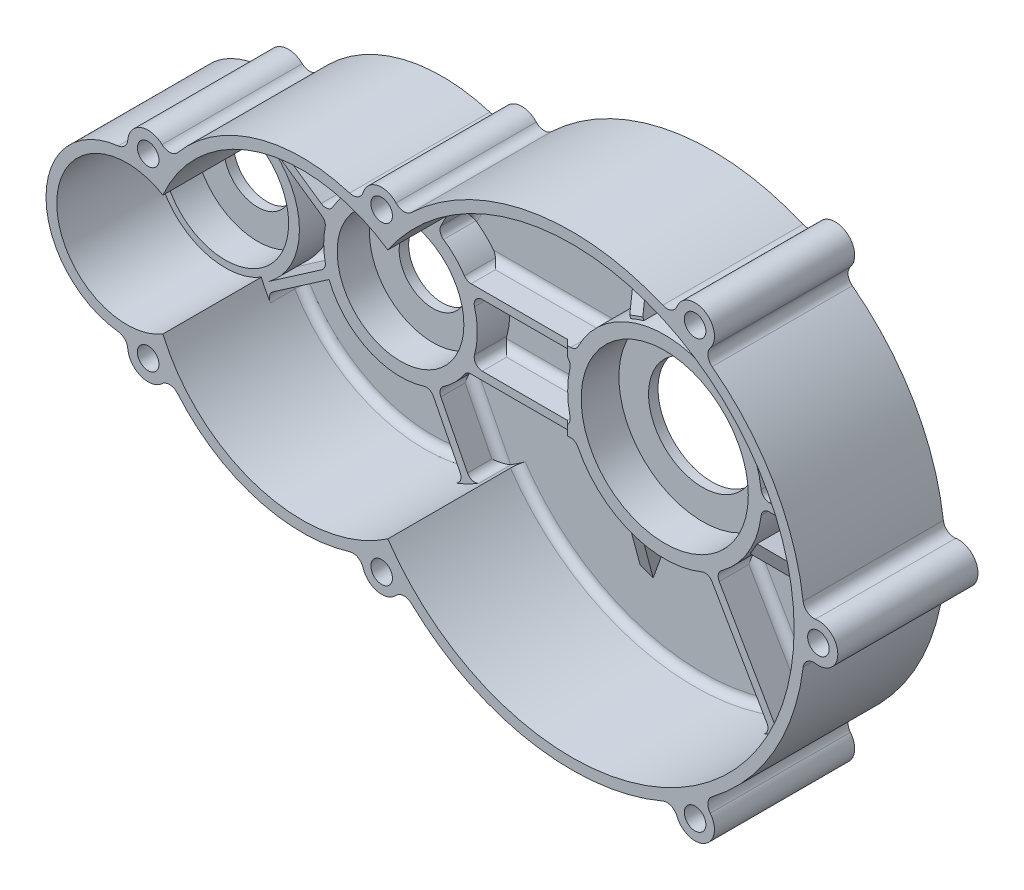
from build123d import *
from OCP.BRepFilletAPI import BRepFilletAPI_MakeChamfer
from build123d.topology import SkipClean

# Parameters (mm, degrees)
WALL_DEPTH                 = 48.5
PLATE_START                = -5
PLATE_DEPTH                = 5
SKETCH3_R                  = 12.5
SKETCH3_R_2                = 20.000000000000018
SKETCH3_R_3                = 12.500000000000002
SHAFT_HOLES_DEPTH          = 5
MOUNT_START                = -53.5
SKETCH5_R                  = 4.000000000000007
SKETCH5_R_2                = 3.9999999999999933
MOUNT_HOLES_DEPTH          = 53.5
SKETCH6_R                  = 23.499999999999996
SKETCH6_R_2                = 30.999999999999993
STIFFNERS_DEPTH            = 12
F_3MM_FILLET_R             = 3
SKETCH9_R                  = 30.999999999999993
SKETCH9_R_2                = 20.000000000000018
OUTPUT_BEARING_WIDTH_DEPTH = 2
F_4MM_FILLET_R             = 4
CUT_EXTRUDE2_DEPTH         = 1.5
FILLET1_R                  = 3
BOSS_EXTRUDE1_START        = -52
SKETCH12_R                 = 5.450634228403444
SKETCH12_R_2               = 4.000000000000007
BOSS_EXTRUDE1_DEPTH        = 52
CUT_EXTRUDE4_START         = -52
SKETCH13_R                 = 4.000000000000017
SKETCH13_R_2               = 4.000000000000002
CUT_EXTRUDE4_DEPTH         = 52
SKETCH15_R                 = 30.999999999999993
SKETCH15_R_2               = 20.000000000000018
BOSS_EXTRUDE3_DEPTH        = 2
CHAMFER1_SIZE              = 12
CHAMFER1_SIZE_2            = 24
SKETCH18_R                 = 30.999999999999993
BOSS_EXTRUDE4_DEPTH        = 2
CHAMFER2_SIZE              = 2


# Some blends are built 0.0001 mm under size
with BuildPart() as part:
    # Sketch1 → wall (new body)
    with BuildSketch(Plane.XY):
        with BuildLine():
            ThreePointArc((11.499519230769218, -27.708501537635847), (48.42153925111643, -57.924236198656324), (95.73906249999997, -51.818650470859374))
            ThreePointArc((95.73906249999997, -51.818650470859374), (251.49999999999997, 0), (95.7390625, 51.818650470859374))
            ThreePointArc((95.7390625, 51.818650470859374), (48.42153925111643, 57.924236198656324), (11.499519230769211, 27.708501537635847))
            ThreePointArc((11.499519230769211, 27.708501537635847), (-29.999999999999982, 3.67e-15), (11.499519230769218, -27.708501537635847))
        make_face()
        with BuildLine():
            ThreePointArc((96.78906249999999, 46.40601259935069), (49.38822629838255, 54.040124184623096), (13.361057692307707, 22.304307596130975))
            ThreePointArc((13.361057692307707, 22.304307596130975), (-26.000000000000018, 3.18e-15), (13.361057692307707, -22.304307596130975))
            ThreePointArc((13.361057692307707, -22.304307596130975), (49.38822629838256, -54.04012418462308), (96.7890625, -46.406012599350674))
            ThreePointArc((96.7890625, -46.406012599350674), (247.49999999999994, 0), (96.78906249999999, 46.40601259935069))
        make_face(mode=Mode.SUBTRACT)
    extrude(amount=WALL_DEPTH)

    # Sketch2 → plate (add)
    with BuildSketch(Plane.XY.offset(PLATE_START)):
        with BuildLine():
            ThreePointArc((11.499519230769224, 27.708501537635843), (-29.999999999999986, 3.67e-15), (11.499519230769224, -27.708501537635843))
            ThreePointArc((11.499519230769224, -27.708501537635843), (48.4215392511164, -57.92423619865631), (95.73906249999995, -51.8186504708594))
            ThreePointArc((95.73906249999995, -51.8186504708594), (251.5, 0), (95.7390625, 51.81865047085939))
            ThreePointArc((95.7390625, 51.81865047085939), (48.421539251116414, 57.92423619865634), (11.499519230769224, 27.708501537635843))
        make_face()
    extrude(amount=PLATE_DEPTH)

    # Sketch3 → shaft holes (cut)
    with BuildSketch(Plane.XY):
        Circle(SKETCH3_R)
        with Locations((164.99999999999997, 0)):
            Circle(SKETCH3_R_2)
        with Locations((65, 0)):
            Circle(SKETCH3_R_3)
    extrude(amount=-SHAFT_HOLES_DEPTH, mode=Mode.SUBTRACT)

    # Sketch5 → mount holes (add)
    # profile 1 of 7: a face of its own
    with BuildSketch(Plane.XY.offset(48.5).offset(MOUNT_START)):
        with BuildLine():
            ThreePointArc((101.66667908580902, 58.9163853438082), (92.93813083409786, 65.21411062740518), (87.70840140116725, 55.806729036949406))
            ThreePointArc((87.70840140116712, 55.80672903694924), (91.79802309926924, 53.96228736785567), (95.73906250000002, 51.81865047085939))
            ThreePointArc((95.7390625, 51.818650470859396), (98.60795378071266, 55.446787091913784), (101.66667908580901, 58.91638534380822))
        make_face()
        with Locations((94.50378031527595, 58.18639821851372)):
            Circle(SKETCH5_R, mode=Mode.SUBTRACT)
    # profile 2 of 7: a face of its own
    with BuildSketch(Plane.XY.offset(48.5).offset(MOUNT_START)):
        with BuildLine():
            Line((9.26823122222287, 29.06952845339508), (9.490438783626573, 28.459296753333007))
            ThreePointArc((9.49043878362604, 28.45929675333257), (10.501690707952559, 28.101859231632734), (11.499519230769211, 27.708501537635847))
            ThreePointArc((11.499519230769195, 27.708501537635858), (13.338247725786175, 31.00202980383327), (15.379467603321658, 34.174043727223726))
            ThreePointArc((15.379467603321867, 34.17404372722366), (5.7955127863149585, 40.13103049599079), (0.8502337303878988, 29.987949289734694))
            ThreePointArc((0.8502337303879592, 29.98794928973486), (3.3240631808321917, 29.815274675404797), (5.775179497135638, 29.438873989605362))
            ThreePointArc((5.775179497135632, 29.43887398960535), (5.96280795706429, 36.32793240711279), (11.89959924691495, 32.82809819681673))
            ThreePointArc((11.89959924691495, 32.82809819681673), (11.1763757041387, 30.534032799016536), (9.268231222222871, 29.069528453395073))
        make_face()
    # profile 3 of 7: a face of its own
    with BuildSketch(Plane.XY.offset(48.5).offset(MOUNT_START)):
        with BuildLine():
            ThreePointArc((217.9499999999998, 79.24132444627627), (209.7711033604413, 86.37446971109887), (203.81617739748285, 77.3017100214936))
            ThreePointArc((203.81617739748305, 77.30171002149383), (208.24999999999994, 74.91119742735394), (212.53715593585014, 72.26665071477065))
            ThreePointArc((212.53715593585014, 72.26665071477062), (216.4380366884417, 74.82700245632823), (217.9499999999998, 79.24132444627627))
        make_face()
        with Locations((210.7499999999998, 79.24132444627627)):
            Circle(SKETCH5_R_2, mode=Mode.SUBTRACT)
    # profile 4 of 7: a face of its own
    with BuildSketch(Plane.XY.offset(48.5).offset(MOUNT_START)):
        with BuildLine():
            ThreePointArc((217.9499999999998, -79.24132444627627), (216.43803668844177, -74.82700245632829), (212.53715593585028, -72.26665071477065))
            ThreePointArc((212.53715593585028, -72.26665071477063), (208.25, -74.91119742735398), (203.81617739748307, -77.30171002149392))
            ThreePointArc((203.81617739748282, -77.30171002149368), (209.77110336044132, -86.37446971109887), (217.9499999999998, -79.24132444627627))
        make_face()
        with Locations((210.7499999999998, -79.24132444627627)):
            Circle(SKETCH5_R_2, mode=Mode.SUBTRACT)
    # profile 5 of 7: a face of its own
    with BuildSketch(Plane.XY.offset(48.5).offset(MOUNT_START)):
        with BuildLine():
            ThreePointArc((95.73906249999999, -51.81865047085938), (91.79802309926922, -53.962287367855666), (87.70840140116712, -55.80672903694922))
            ThreePointArc((87.70840140116727, -55.80672903694938), (92.9381308340978, -65.21411062740516), (101.66667908580902, -58.91638534380828))
            ThreePointArc((101.666679085809, -58.9163853438083), (98.60795378071265, -55.446787091913855), (95.73906249999995, -51.8186504708594))
        make_face()
        with Locations((94.50378031527595, -58.18639821851372)):
            Circle(SKETCH5_R, mode=Mode.SUBTRACT)
    # profile 6 of 7: a face of its own
    with BuildSketch(Plane.XY.offset(48.5).offset(MOUNT_START)):
        with BuildLine():
            ThreePointArc((5.775179497135616, -29.438873989605376), (3.32406318083218, -29.815274675404805), (0.8502337303879735, -29.987949289734868))
            ThreePointArc((0.8502337303878997, -29.987949289734694), (5.79551278631497, -40.1310304959908), (15.37946760332187, -34.17404372722364))
            ThreePointArc((15.379467603321679, -34.17404372722369), (13.33824772578619, -31.00202980383326), (11.499519230769216, -27.708501537635847))
            ThreePointArc((11.499519230769204, -27.708501537635858), (9.890853137572314, -28.32262389347031), (8.249602696185828, -28.843440421612033))
            ThreePointArc((8.249602696185844, -28.84344042161213), (10.849176657077596, -30.12624825622821), (11.89959924691495, -32.82809819681673))
            ThreePointArc((11.89959924691495, -32.82809819681673), (5.962807957064298, -36.3279324071128), (5.775179497135614, -29.438873989605366))
        make_face()
    # profile 7 of 7: a face of its own
    with BuildSketch(Plane.XY.offset(48.5).offset(MOUNT_START)):
        with BuildLine():
            ThreePointArc((263.7, 0), (259.2188232748746, 6.6669333280002085), (251.3533333333333, 5.0350593067233405))
            ThreePointArc((251.35333333333332, 5.035059306723314), (251.5, -4.086e-14), (251.35333333333332, -5.035059306723381))
            ThreePointArc((251.3533333333333, -5.035059306723358), (259.2188232748746, -6.666933328000204), (263.7, -1.76e-15))
        make_face()
        with Locations((256.5, 0)):
            Circle(SKETCH5_R_2, mode=Mode.SUBTRACT)
    extrude(amount=MOUNT_HOLES_DEPTH)

    # Sketch6 → Stiffners (add)
    with BuildSketch(Plane.XY):
        with BuildLine():
            Line((38.49565795212308, 10.477110890371637), (15.361110193046382, 26.45832796555964))
            ThreePointArc((15.361110193046379, 26.45832796555964), (14.650603173573039, 25.07988714518038), (13.978365384615408, 23.682383773053473))
            ThreePointArc((13.978365384615401, 23.68238377305348), (13.665087055376269, 22.995417216652143), (13.36105769230771, 22.304307596130975))
            ThreePointArc((13.361057692307707, 22.304307596130975), (-26.000000000000018, 2.66e-15), (13.361057692307707, -22.304307596130972))
            ThreePointArc((13.361057692307703, -22.30430759613098), (13.665087055376254, -22.995417216652143), (13.978365384615394, -23.682383773053488))
            ThreePointArc((13.978365384615415, -23.68238377305348), (14.650603173573039, -25.07988714518039), (15.361110193046379, -26.458327965559644))
            Line((15.361110193046382, -26.45832796555964), (38.495657952123096, -10.477110890371636))
            ThreePointArc((38.495657952123096, -10.477110890371629), (53.929607396747244, -26.262071654952244), (76.00608927382068, -26.289085166598902))
            Line((76.00608927382068, -26.289085166598888), (88.57264066064552, -51.072430060494305))
            ThreePointArc((88.57264066064552, -51.07243006049431), (89.9262590361775, -50.42562949990193), (91.2621470799294, -49.7429606150675))
            Line((91.2621470799294, -49.742960615067496), (78.70908383956089, -24.986216605958777))
            ThreePointArc((78.70908383956089, -24.986216605958774), (84.82436425632805, -20.475462921077565), (89.5303135118925, -14.5090909090909))
            Line((89.5303135118925, -14.509090909090904), (132.05328118018826, -14.509090909090904))
            ThreePointArc((132.05328118018826, -14.509090909090904), (139.50484136144325, -25.41646879475638), (150.38913268183015, -32.90171053624472))
            Line((150.38913268183015, -32.901710536244714), (141.8702883993316, -56.50059353862132))
            Line((141.8702883993316, -56.50059353862132), (144.22176781945507, -57.34944248674798))
            Line((144.22176781945507, -57.34944248674798), (146.70761749215703, -58.246797089053324))
            Line((146.70761749215703, -58.246797089053324), (155.22646177465555, -34.647914086676714))
            ThreePointArc((155.22646177465555, -34.64791408667671), (168.44150012774992, -35.835123508517405), (181.18905024214683, -32.154543259969415))
            Line((181.18905024214683, -32.154543259969415), (204.95552203895156, -73.31927992868806))
            Line((204.95552203895156, -73.31927992868806), (206.0662177137105, -75.24306126911748))
            Line((206.0662177137105, -75.24306126911748), (208.66429392506384, -73.74306126911746))
            Line((208.66429392506384, -73.74306126911746), (207.54404600113688, -71.80273494780248))
            Line((207.54404600113688, -71.80273494780248), (183.8103637094438, -30.69479136789232))
            ThreePointArc((183.8103637094438, -30.69479136789232), (189.7796734340188, -26.114512909556225), (194.66656248566662, -20.39350559085019))
            Line((194.66656248566662, -20.39350559085019), (215.44417626570595, -32.588300443139836))
            Line((215.44417626570595, -32.588300443139836), (216.70961894883547, -30.432226507553672))
            Line((216.70961894883547, -30.432226507553672), (218.04737264242948, -28.152948347076958))
            Line((218.04737264242948, -28.152948347076958), (197.2697588623901, -15.958153494787352))
            ThreePointArc((197.2697588623901, -15.958153494787355), (199.87667716951003, -8.922857704445132), (200.96873642484536, -1.4999999999999987))
            Line((200.96873642484536, -1.5), (247.4613630023896, -1.5))
            Line((247.4613630023896, -1.5), (249.23500443972713, -1.5))
            Line((249.23500443972713, -1.5), (249.23500443972713, 1.5))
            Line((249.23500443972713, 1.5), (247.4613630023896, 1.5))
            Line((247.4613630023896, 1.5), (200.96873642484536, 1.5))
            ThreePointArc((200.96873642484536, 1.5), (199.87667716951003, 8.922857704445134), (197.2697588623901, 15.958153494787352))
            Line((197.2697588623901, 15.958153494787352), (218.04737264242948, 28.152948347076958))
            Line((218.04737264242948, 28.152948347076958), (216.70961894883547, 30.432226507553672))
            Line((216.70961894883547, 30.432226507553672), (215.44417626570595, 32.588300443139836))
            Line((215.44417626570595, 32.588300443139836), (194.66656248566662, 20.39350559085019))
            ThreePointArc((194.66656248566662, 20.39350559085019), (189.77967343401883, 26.11451290955626), (183.8103637094438, 30.69479136789232))
            Line((183.8103637094438, 30.69479136789232), (207.54404600113688, 71.80273494780248))
            Line((207.54404600113688, 71.80273494780248), (208.66429392506382, 73.74306126911748))
            Line((208.66429392506382, 73.74306126911748), (206.06621771371047, 75.24306126911749))
            Line((206.06621771371047, 75.24306126911749), (204.95552203895156, 73.31927992868806))
            Line((204.95552203895156, 73.31927992868806), (181.18905024214683, 32.154543259969415))
            ThreePointArc((181.18905024214683, 32.15454325996943), (168.44150012774992, 35.83512350851741), (155.22646177465555, 34.64791408667672))
            Line((155.22646177465555, 34.647914086676714), (146.70761749215703, 58.246797089053324))
            Line((146.70761749215703, 58.246797089053324), (144.22176781945507, 57.34944248674798))
            Line((144.22176781945507, 57.34944248674798), (141.8702883993316, 56.50059353862132))
            Line((141.8702883993316, 56.50059353862132), (150.38913268183015, 32.901710536244714))
            ThreePointArc((150.38913268183015, 32.90171053624471), (139.50484136144325, 25.41646879475638), (132.05328118018826, 14.509090909090904))
            Line((132.05328118018826, 14.509090909090904), (89.5303135118925, 14.509090909090904))
            ThreePointArc((89.5303135118925, 14.509090909090908), (84.82436425632805, 20.47546292107758), (78.70908383956089, 24.98621660595878))
            Line((78.70908383956089, 24.986216605958777), (91.2621470799294, 49.742960615067496))
            ThreePointArc((91.2621470799294, 49.7429606150675), (89.9262590361775, 50.42562949990193), (88.57264066064552, 51.07243006049431))
            Line((88.57264066064552, 51.072430060494305), (76.00608927382068, 26.289085166598888))
            ThreePointArc((76.00608927382068, 26.289085166598884), (53.92960739674723, 26.26207165495225), (38.49565795212308, 10.477110890371636))
        make_face()
        with BuildLine():
            ThreePointArc((14.42604396178424, -18.55099069086793), (13.435981266119917, -19.280155793366266), (12.409134615384627, -19.956537227115913))
            ThreePointArc((12.40913461538461, -19.956537227115916), (-23.499999999999996, 1.421e-14), (12.409134615384627, 19.956537227115913))
            ThreePointArc((12.409134615384623, 19.956537227115913), (23.46783178961601, 1.2291749648801886), (14.42604396178424, -18.55099069086793))
        make_face(mode=Mode.SUBTRACT)
        with BuildLine():
            Line((15.630120525159256, 22.626297363223088), (36.82968655308099, 7.981754918727974))
            Line((36.82968655308099, 7.981754918727974), (37.50812138300684, 7.513095907048813))
            ThreePointArc((37.50812138300684, 7.513095907048813), (36.500000000000014, 1.78e-15), (37.50812138300684, -7.51309590704881))
            Line((37.50812138300684, -7.513095907048813), (36.82968655308099, -7.981754918727974))
            Line((36.82968655308099, -7.981754918727974), (15.630120525159256, -22.626297363223088))
            ThreePointArc((15.630120525159251, -22.626297363223095), (27.500000000000014, -4.44e-15), (15.630120525159256, 22.626297363223088))
        make_face(mode=Mode.SUBTRACT)
        with Locations((65, 0)):
            Circle(SKETCH6_R, mode=Mode.SUBTRACT)
        with BuildLine():
            ThreePointArc((91.07279859252324, -11.509090909090903), (93.50000000000001, -1.78e-15), (91.07279859252324, 11.5090909090909))
            Line((91.07279859252324, 11.5090909090909), (130.88928575291507, 11.509090909090903))
            ThreePointArc((130.88928575291507, 11.509090909090904), (128.99999999999997, -8.9e-16), (130.88928575291507, -11.509090909090904))
            Line((130.88928575291507, -11.509090909090903), (91.07279859252324, -11.5090909090909))
        make_face(mode=Mode.SUBTRACT)
        with Locations((164.99999999999997, 0)):
            Circle(SKETCH6_R_2, mode=Mode.SUBTRACT)
    extrude(amount=STIFFNERS_DEPTH)

    # 3mm fillet
    f_3mm_fillet_edges = [part.edges().sort_by_distance(p)[0] for p in [
        (110.98104217271916, -11.5090909090909, 0),
        (110.98104217271916, 11.5090909090909, 0),
        (26.569120954083047, 15.069696635135951, 0),
        (26.569120954083047, -15.069696635135951, 0),
        (82.2893649672331, -38.6807576135466, 0),
        (192.82234326351562, -52.30399783231661, 0),
        (145.60066709662624, -80.1867562812219, 0),
        (84.98561545974515, -37.36458861051314, 0),
        (224.2275494670252, -1.4999999999999993, 0),
        (236.30738743441992, -41.49104116887794, 0),
        (195.43710399088877, -50.83289626176263, 0),
        (195.43710399088877, 50.83289626176265, 0),
        (236.30738743441995, 41.49104116887794, 0),
        (224.2275494670252, 1.5, 0),
        (84.98561545974515, 37.36458861051314, 0),
        (145.60066709662627, 80.1867562812219, 0),
        (192.82234326351562, 52.30399783231663, 0),
        (26.928384072584734, 18.467719427965637, 0),
        (47.07443608629511, 53.31732043506765, 0),
        (82.2893649672331, 38.6807576135466, 0),
        (91.07279859252324, -11.5090909090909, 6),
        (91.07279859252324, 11.5090909090909, 6),
        (130.88928575291507, 11.509090909090904, 6),
        (130.88928575291507, -11.5090909090909, 6),
        (247.4863625092051, 1.5, 6),
        (247.4863625092051, -1.5, 6),
        (207.06384427233368, 70.97100115563295, 6),
        (204.45563628488443, 72.45345240466398, 6),
        (181.18905024214683, 32.15454325996942, 6),
        (200.96873642484536, 1.5, 6),
        (183.8103637094438, -30.69479136789232, 6),
        (207.06384427233368, -70.97100115563296, 6),
        (204.45563628488446, -72.45345240466395, 6),
        (78.70908383956089, -24.986216605958774, 6),
        (76.00608927382068, -26.28908516659889, 6),
        (15.361110193046377, 26.45832796555964, 6),
        (88.57264066064552, 51.07243006049431, 6),
        (91.2621470799294, 49.7429606150675, 6),
        (76.00608927382068, 26.28908516659888, 6),
        (78.70908383956089, 24.98621660595878, 6),
        (37.50812138300684, -7.513095907048809, 6),
        (37.50812138300684, 7.513095907048813, 6),
        (38.49565795212308, 10.477110890371637, 6),
        (88.57264066064552, -51.07243006049431, 6),
        (91.2621470799294, -49.7429606150675, 6),
        (110.79179734604038, 14.509090909090904, 0),
        (110.79179734604038, -14.509090909090904, 0),
        (89.5303135118925, -14.5090909090909, 6),
        (89.5303135118925, 14.509090909090906, 6),
        (132.05328118018826, -14.509090909090904, 6),
        (47.074436086295115, -53.317320435067636, 0),
        (200.96873642484536, -1.4999999999999987, 6),
        (181.18905024214683, -32.154543259969415, 6),
        (26.92838407258474, -18.467719427965637, 0),
        (15.361110193046377, -26.458327965559647, 6),
        (183.8103637094438, 30.694791367892325, 6),
    ]]
    fillet(f_3mm_fillet_edges, radius=F_3MM_FILLET_R)

    # Sketch9 → output bearing width (cut)
    with BuildSketch(Plane.XY):
        with Locations((164.99999999999997, 0)):
            Circle(SKETCH9_R)
        with Locations((164.99999999999997, 0)):
            Circle(SKETCH9_R_2, mode=Mode.SUBTRACT)
    extrude(amount=-OUTPUT_BEARING_WIDTH_DEPTH, mode=Mode.SUBTRACT)

    # 4mm fillet
    f_4mm_fillet_edges = [part.edges().sort_by_distance(p)[0] for p in [
        (101.66667908580901, -58.91638534380829, 21.75),
        (87.7084014011672, -55.80672903694931, 21.75),
        (0.8502337303879346, -29.98794928973478, 21.75),
        (15.379467603321775, -34.17404372722366, 21.75),
        (251.35333333333332, -5.035059306723372, 21.75),
        (251.3533333333333, 5.0350593067233325, 21.75),
        (101.666679085809, 58.916385343808216, 21.75),
        (87.70840140116718, 55.80672903694933, 21.75),
        (15.379467603321762, 34.17404372722369, 21.75),
        (0.8502337303879282, 29.98794928973478, 21.75),
        (212.53715593585014, 72.26665071477062, 21.75),
        (203.81617739748293, 77.3017100214937, 21.75),
        (212.53715593585028, -72.26665071477063, 21.75),
        (203.81617739748293, -77.3017100214938, 21.75),
    ]]
    fillet(f_4mm_fillet_edges, radius=F_4MM_FILLET_R)

    # Sketch10 → Cut-Extrude2 (cut)
    with BuildSketch(Plane(origin=(0, 0, -5), x_dir=(-1, 0, 0), z_dir=(0, 0, -1))):
        with BuildLine():
            ThreePointArc((-82.6176970674836, -57.6166577478977), (-47.90235166391932, -57.77311590502729), (-18.863420494799847, -38.74891652111507))
            ThreePointArc((-18.863420494799847, -38.74891652111507), (-16.046136877516886, -37.32901347787043), (-13.075993198050156, -38.392713696799696))
            ThreePointArc((-13.075993198050156, -38.392713696799696), (-5.160438728778773, -39.917315336662554), (-0.32645941471191703, -33.46649703915576))
            ThreePointArc((-0.32645941471191703, -33.46649703915576), (0.7976038953600568, -31.00784043377143), (3.228885577825256, -29.825732143994575))
            ThreePointArc((3.228885577825256, -29.825732143994575), (29.999999999999986, 0), (3.2288855778252588, 29.825732143994575))
            ThreePointArc((3.2288855778252588, 29.825732143994575), (0.7976038953600564, 31.007840433771435), (-0.32645941471192047, 33.46649703915577))
            ThreePointArc((-0.32645941471192047, 33.46649703915577), (-5.160438728778768, 39.91731533666256), (-13.075993198050151, 38.39271369679971))
            ThreePointArc((-13.075993198050151, 38.39271369679971), (-16.04613687751688, 37.32901347787046), (-18.86342049479984, 38.74891652111508))
            ThreePointArc((-18.86342049479984, 38.74891652111508), (-47.9023516639193, 57.77311590502729), (-82.61769706748356, 57.61665774789772))
            ThreePointArc((-82.61769706748356, 57.61665774789772), (-85.66830507037658, 57.911680189171044), (-87.61463799555334, 60.279175822227764))
            ThreePointArc((-87.61463799555334, 60.279175822227764), (-92.92038028133871, 65.21013257656911), (-99.82861978961255, 63.03264259664271))
            ThreePointArc((-99.82861978961255, 63.03264259664271), (-102.6379731089084, 61.72777260502753), (-105.53661581198773, 62.820028182967654))
            ThreePointArc((-105.53661581198773, 62.820028182967654), (-149.64073322150355, 85.12545403125303), (-198.7591392136407, 79.64025690286307))
            ThreePointArc((-198.7591392136407, 79.64025690286307), (-201.87208948160787, 79.63633598021674), (-204.04516423576405, 81.86528659818038))
            ThreePointArc((-204.04516423576405, 81.86528659818038), (-214.34999999999977, 85.47670735352425), (-216.37483576423554, 74.74674742219776))
            ThreePointArc((-216.37483576423554, 74.74674742219776), (-215.53104528237617, 71.75033417179398), (-217.09091603497777, 69.05640062033994))
            ThreePointArc((-217.09091603497777, 69.05640062033994), (-239.91119742735387, 43.25000000000001), (-250.85005524861882, 10.583856282523007))
            ThreePointArc((-250.85005524861882, 10.583856282523007), (-252.40313476398438, 7.8860018084227095), (-255.42, 7.118539175982654))
            ThreePointArc((-255.42, 7.118539175982654), (-263.7, 8.8e-16), (-255.42, -7.118539175982638))
            ThreePointArc((-255.42, -7.118539175982638), (-252.4031347639844, -7.886001808422654), (-250.85005524861882, -10.58385628252294))
            ThreePointArc((-250.85005524861882, -10.58385628252294), (-239.91119742735395, -43.25000000000005), (-217.09091603497774, -69.05640062034004))
            ThreePointArc((-217.09091603497774, -69.05640062034004), (-215.5310452823761, -71.75033417179401), (-216.37483576423554, -74.74674742219771))
            ThreePointArc((-216.37483576423554, -74.74674742219771), (-214.3499999999998, -85.47670735352425), (-204.04516423576405, -81.86528659818038))
            ThreePointArc((-204.04516423576405, -81.86528659818038), (-201.87208948160776, -79.63633598021673), (-198.75913921364054, -79.64025690286304))
            ThreePointArc((-198.75913921364054, -79.64025690286304), (-149.64073322150344, -85.12545403125296), (-105.53661581198767, -62.820028182967654))
            ThreePointArc((-105.53661581198767, -62.820028182967654), (-102.63797310890837, -61.72777260502754), (-99.82861978961256, -63.032642596642724))
            ThreePointArc((-99.82861978961256, -63.032642596642724), (-92.9203802813387, -65.21013257656912), (-87.61463799555334, -60.27917582222775))
            ThreePointArc((-87.61463799555334, -60.27917582222775), (-85.66830507037663, -57.911680189171), (-82.6176970674836, -57.6166577478977))
        make_face()
    extrude(amount=-CUT_EXTRUDE2_DEPTH, mode=Mode.SUBTRACT)

    # Fillet1
    # the kernel refuses this fillet: 3 mm, written as the material it adds along each edge
    with BuildSketch(Plane(origin=(132.05328118018826, 14.509090909090904, -1.7549473493717191), x_dir=(0.4261279424020825, 0.9046629077751378, 0), z_dir=(0, 0, 1))) as fillet1_piece_1:
        with BuildLine():
            CenterArc((1.9035023512382108, 2.9990336253663687), FILLET1_R, 205.22207939438857, 63.32359576393128)
            Line((-0.8104863720872026, 1.7206497981601212), (0, 0))
            ThreePointArc((0, 0), (0.9136811285943572, 0.01159649560360848), (1.82736225718868, -4e-17))
        make_face()
    extrude(amount=13.754947349371719)

    # Sketch12 → Boss-Extrude1 (add)
    with SkipClean():  # the faces are left unmerged after this step: merging them gives an invalid solid
        with BuildSketch(Plane.XY.offset(48.5).offset(BOSS_EXTRUDE1_START)):
            with Locations((7.899599246914947, 32.82809819681673)):
                Circle(SKETCH12_R)
            with Locations((7.899599246914947, 32.82809819681673)):
                Circle(SKETCH12_R_2, mode=Mode.SUBTRACT)
        extrude(amount=BOSS_EXTRUDE1_DEPTH)

    # Sketch13 → Cut-Extrude4 (cut)
    with SkipClean():  # the faces are left unmerged after this step: merging them gives an invalid solid
        with BuildSketch(Plane.XY.offset(48.5).offset(CUT_EXTRUDE4_START)):
            with Locations((7.899599246914947, 32.82809819681673)):
                Circle(SKETCH13_R)
            with Locations((7.899599246914947, -32.82809819681673)):
                Circle(SKETCH13_R_2)
        extrude(amount=CUT_EXTRUDE4_DEPTH, mode=Mode.SUBTRACT)

    # Sketch15 → Boss-Extrude3 (add)
    with BuildSketch(Plane.XY.offset(-2)):
        with Locations((164.99999999999997, 0)):
            Circle(SKETCH15_R)
        with Locations((164.99999999999997, 0)):
            Circle(SKETCH15_R_2, mode=Mode.SUBTRACT)
    extrude(amount=BOSS_EXTRUDE3_DEPTH)

    # Chamfer1
    chamfer1_edges_1 = [part.edges().sort_by_distance(p)[0] for p in [
        (144.2889529457443, -57.37369531383732, 12),
    ]]
    chamfer1_side_1 = [part.faces().sort_by_distance(p)[0] for p in [
        (144.2889529457443, -57.37369531383732, 11.76),
    ]]
    chamfer1_edges_2 = [part.edges().sort_by_distance(p)[0] for p in [
        (144.2889529457443, 57.373695313837324, 12),
    ]]
    chamfer1_side_2 = [part.faces().sort_by_distance(p)[0] for p in [
        (144.2889529457443, 57.373695313837324, 11.76),
    ]]
    chamfer1_edges_3 = [part.edges().sort_by_distance(p)[0] for p in [
        (216.7457744540677, 30.370624395108397, 12),
    ]]
    chamfer1_side_3 = [part.faces().sort_by_distance(p)[0] for p in [
        (216.7457744540677, 30.370624395108397, 11.76),
    ]]
    chamfer1_edges_4 = [part.edges().sort_by_distance(p)[0] for p in [
        (216.7457744540677, -30.370624395108397, 12),
    ]]
    chamfer1_side_4 = [part.faces().sort_by_distance(p)[0] for p in [
        (216.7457744540677, -30.370624395108397, 11.76),
    ]]
    chamfer1 = BRepFilletAPI_MakeChamfer(part.part.solid().wrapped)
    for e in chamfer1_edges_1:
        chamfer1.Add(CHAMFER1_SIZE - 0.0001, CHAMFER1_SIZE_2 - 0.0001, e.wrapped, chamfer1_side_1[0].wrapped)
    for e in chamfer1_edges_2:
        chamfer1.Add(CHAMFER1_SIZE - 0.0001, CHAMFER1_SIZE_2 - 0.0001, e.wrapped, chamfer1_side_2[0].wrapped)
    for e in chamfer1_edges_3:
        chamfer1.Add(CHAMFER1_SIZE - 0.0001, CHAMFER1_SIZE_2 - 0.0001, e.wrapped, chamfer1_side_3[0].wrapped)
    for e in chamfer1_edges_4:
        chamfer1.Add(CHAMFER1_SIZE - 0.0001, CHAMFER1_SIZE_2 - 0.0001, e.wrapped, chamfer1_side_4[0].wrapped)
    add(Compound.cast(chamfer1.Shape()), mode=Mode.REPLACE)  # a hair under: the kernel refuses the full size

    # Sketch18 → Boss-Extrude4 (add)
    with BuildSketch(Plane.XY.offset(12)):
        with BuildLine():
            Line((203.73951471043483, 1.5), (244.37253933193767, 1.5))
            ThreePointArc((244.37253933193767, 1.5), (246.55307068487258, 2.439591540769665), (247.36772949540702, 4.669811320754719))
            ThreePointArc((247.36772949540702, 4.669811320754719), (247.49999999999994, 0), (247.36772949540702, -4.669811320754719))
            ThreePointArc((247.36772949540702, -4.669811320754719), (246.55307068487258, -2.4395915407696678), (244.37253933193767, -1.5))
            Line((244.37253933193767, -1.5), (203.73951471043483, -1.5))
            ThreePointArc((203.73951471043483, -1.5), (201.7443281951513, -2.2596360185829694), (200.7595520404014, -4.153846153846155))
            ThreePointArc((200.7595520404014, -4.153846153846155), (196.0467784259508, -18.223543820286793), (186.05972664573343, -29.197395664801736))
            ThreePointArc((186.05972664573343, -29.197395664801736), (184.8813406917909, -31.001719089393955), (185.21662765485794, -33.13051197020188))
            Line((185.21662765485794, -33.13051197020188), (205.51762096097048, -68.29286382050452))
            ThreePointArc((205.51762096097048, -68.29286382050452), (207.41135970617225, -69.70901003319264), (209.74270461278888, -69.3133492476934))
            ThreePointArc((209.74270461278888, -69.3133492476934), (205.74747225766663, -71.73488345714854), (201.6215743389354, -73.92638428151227))
            ThreePointArc((201.6215743389354, -73.92638428151227), (203.16148217254005, -72.10642923350902), (202.8879569379638, -69.73815212582095))
            Line((202.8879569379638, -69.73815212582095), (182.55382668638248, -34.51840540235876))
            ThreePointArc((182.55382668638248, -34.51840540235876), (180.91884269771512, -33.17719907922735), (178.80530813079613, -33.2477588329465))
            ThreePointArc((178.80530813079613, -33.2477588329465), (152.45902179850097, -33.74498282336985), (132.8319712988673, -16.16223776223776))
            ThreePointArc((132.8319712988673, -16.16223776223776), (131.7260150014599, -14.95560706925958), (130.15130224043958, -14.509090909090904))
            Line((130.15130224043958, -14.509090909090904), (126.93958261000246, -14.509090909090906))
            Line((126.93958261000246, -14.509090909090906), (126.93958261000246, -11.509090909090903))
            ThreePointArc((126.93958261000246, -11.509090909090903), (129.2809109043299, -10.384772603350836), (129.86730702461765, -7.854545454545449))
            ThreePointArc((129.86730702461765, -7.854545454545449), (128.99999999999997, 4.41e-15), (129.86730702461765, 7.854545454545449))
            ThreePointArc((129.86730702461765, 7.854545454545449), (129.2809109043299, 10.38477260335083), (126.93958261000246, 11.509090909090903))
            Line((126.93958261000246, 11.509090909090903), (126.93958261000246, 14.509090909090904))
            Line((126.93958261000246, 14.509090909090904), (130.15130224043958, 14.509090909090904))
            ThreePointArc((130.15130224043958, 14.509090909090904), (131.7260150014599, 14.955607069259582), (132.8319712988673, 16.16223776223776))
            ThreePointArc((132.8319712988673, 16.16223776223776), (152.45902179850097, 33.744982823369845), (178.80530813079613, 33.2477588329465))
            ThreePointArc((178.80530813079613, 33.2477588329465), (180.91884269771512, 33.177199079227314), (182.55382668638248, 34.51840540235876))
            Line((182.55382668638248, 34.51840540235876), (202.8879569379638, 69.73815212582095))
            ThreePointArc((202.8879569379638, 69.73815212582095), (203.16148217254002, 72.10642923350902), (201.6215743389354, 73.92638428151227))
            ThreePointArc((201.6215743389354, 73.92638428151227), (205.74747225766663, 71.73488345714856), (209.74270461278888, 69.3133492476934))
            ThreePointArc((209.74270461278888, 69.3133492476934), (207.41135970617225, 69.70901003319265), (205.51762096097048, 68.29286382050452))
            Line((205.51762096097048, 68.29286382050452), (185.21662765485794, 33.13051197020188))
            ThreePointArc((185.21662765485794, 33.13051197020188), (184.8813406917909, 31.00171908939396), (186.05972664573343, 29.197395664801736))
            ThreePointArc((186.05972664573343, 29.197395664801736), (196.0467784259508, 18.2235438202868), (200.7595520404014, 4.153846153846155))
            ThreePointArc((200.7595520404014, 4.153846153846155), (201.7443281951513, 2.2596360185829756), (203.73951471043483, 1.5))
        make_face()
        with Locations((164.99999999999997, 0)):
            Circle(SKETCH18_R, mode=Mode.SUBTRACT)
    extrude(amount=BOSS_EXTRUDE4_DEPTH)

    # Chamfer2
    # the kernel refuses this chamfer: 2 mm, written as the material it takes off along each edge
    with BuildSketch(Plane(origin=(126.93958261000246, 6.36572493315908, 14), x_dir=(0.9996219169112968, 0, 0.027495876610586795), z_dir=(0, 1, 0))) as chamfer2_piece_1_section:
        Polygon((CHAMFER2_SIZE * 0.999621916911, CHAMFER2_SIZE * 0.0274958766106), (-CHAMFER2_SIZE * 0.0274958766106, CHAMFER2_SIZE * 0.999621916911), (0, 0), align=None)
    chamfer2_piece_1 = extrude(amount=13.286731951863647, mode=Mode.PRIVATE)
    chamfer2_piece_1 = split(chamfer2_piece_1, bisect_by=Plane(origin=(127.6003909186423, 13.009090909090911, 12), z_dir=(0, 0, 1)), keep=Keep.TOP, mode=Mode.PRIVATE)
    add(chamfer2_piece_1, mode=Mode.SUBTRACT)
    with BuildSketch(Plane(origin=(126.93958261000246, -19.65245688502273, 14), x_dir=(0.9996219169112968, 0, 0.027495876610586795), z_dir=(0, 1, 0))) as chamfer2_piece_2_section:
        Polygon((CHAMFER2_SIZE * 0.999621916911, CHAMFER2_SIZE * 0.0274958766106), (-CHAMFER2_SIZE * 0.0274958766106, CHAMFER2_SIZE * 0.999621916911), (0, 0), align=None)
    chamfer2_piece_2 = extrude(amount=13.28673195186365, mode=Mode.PRIVATE)
    chamfer2_piece_2 = split(chamfer2_piece_2, bisect_by=Plane(origin=(127.60039091864229, -13.009090909090904, 12), z_dir=(0, 0, 1)), keep=Keep.TOP, mode=Mode.PRIVATE)
    add(chamfer2_piece_2, mode=Mode.SUBTRACT)


solid = part.part
